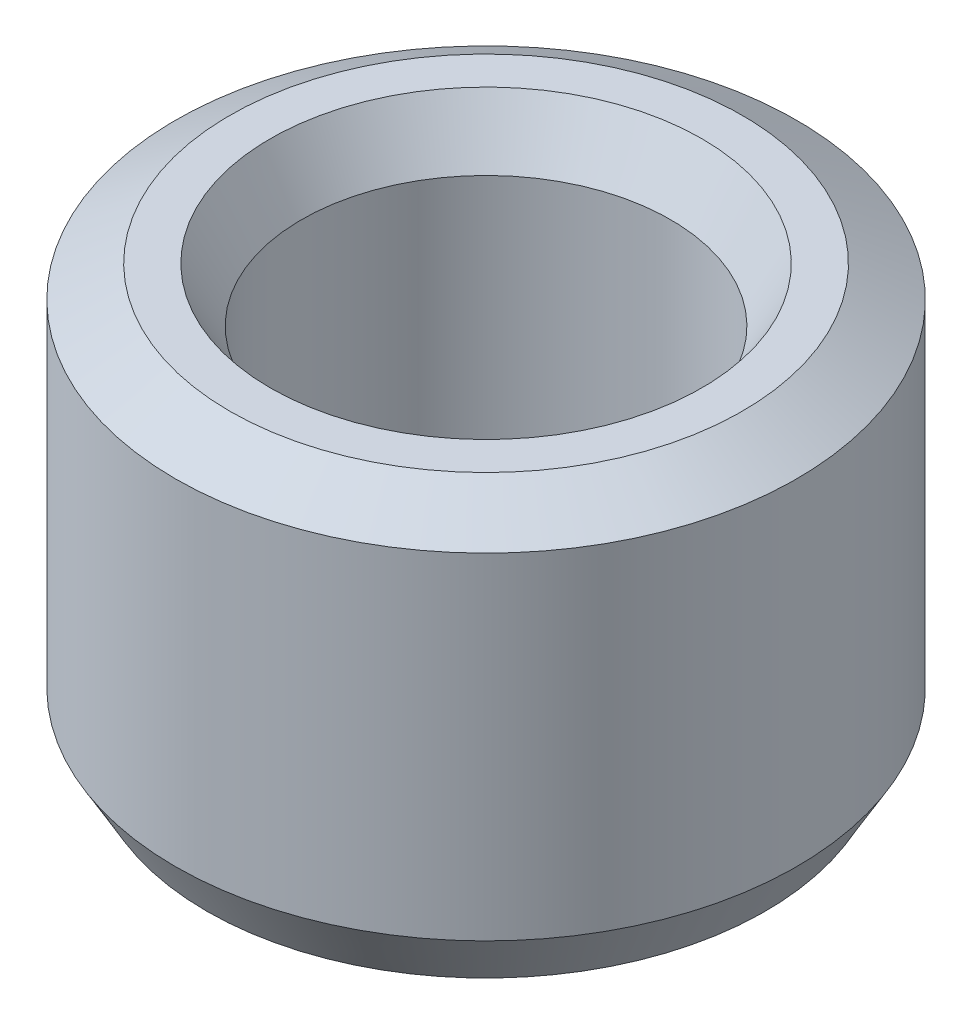
from build123d import *
from OCP.BRepFilletAPI import BRepFilletAPI_MakeChamfer

# Parameters (mm, degrees)
SKETCH1_R           = 15
BOSS_EXTRUDE1_DEPTH = 20.357849496
SKETCH2_R           = 8.90814744
CUT_EXTRUDE1_DEPTH  = 30.401395139
CHAMFER1_SIZE       = 1.515475572
CHAMFER1_SIZE2      = 2.624880689


with BuildPart() as part:
    # Sketch1 → Boss-Extrude1 (new body)
    with BuildSketch(Plane(origin=(0, 0, 0), x_dir=(1, 0, 0), z_dir=(0, 1, 0))):
        Circle(SKETCH1_R)
    extrude(amount=BOSS_EXTRUDE1_DEPTH)

    # Sketch2 → Cut-Extrude1 (cut, through all)
    with BuildSketch(Plane(origin=(0, 0, 0), x_dir=(1, 0, 0), z_dir=(0, 1, 0))):
        Circle(SKETCH2_R)
    extrude(amount=CUT_EXTRUDE1_DEPTH, mode=Mode.SUBTRACT)

    # Chamfer1: one chamfer whose edges measure the first distance from different faces: ONE call of the kernel's chamfer builder (chamfer() names one face for all edges)
    chamfer1_edges_1 = [part.edges().sort_by_distance(p)[0] for p in [
        (-8.90814744, 20.357849496, 0),
    ]]
    chamfer1_side_1 = [part.faces().sort_by_distance(p)[0] for p in [
        (-14.575735931, 20.357849496, 0),
    ]]
    chamfer1_edges_2 = [part.edges().sort_by_distance(p)[0] for p in [
        (-8.90814744, 0, 0),
    ]]
    chamfer1_side_2 = [part.faces().sort_by_distance(p)[0] for p in [
        (-8.90814744, 10.178924748, 0),
    ]]
    chamfer1_edges_3 = [part.edges().sort_by_distance(p)[0] for p in [
        (-15, 0, 0),
    ]]
    chamfer1_side_3 = [part.faces().sort_by_distance(p)[0] for p in [
        (-14.575735931, 0, 0),
    ]]
    chamfer1_edges_4 = [part.edges().sort_by_distance(p)[0] for p in [
        (-15, 20.357849496, 0),
    ]]
    chamfer1_side_4 = [part.faces().sort_by_distance(p)[0] for p in [
        (-15, 10.178924748, 0),
    ]]
    chamfer1 = BRepFilletAPI_MakeChamfer(part.part.solid().wrapped)
    for e in chamfer1_edges_1:
        chamfer1.Add(CHAMFER1_SIZE, CHAMFER1_SIZE2, e.wrapped, chamfer1_side_1[0].wrapped)  # the first distance lies on this face
    for e in chamfer1_edges_2:
        chamfer1.Add(CHAMFER1_SIZE, CHAMFER1_SIZE2, e.wrapped, chamfer1_side_2[0].wrapped)  # the first distance lies on this face
    for e in chamfer1_edges_3:
        chamfer1.Add(CHAMFER1_SIZE, CHAMFER1_SIZE2, e.wrapped, chamfer1_side_3[0].wrapped)  # the first distance lies on this face
    for e in chamfer1_edges_4:
        chamfer1.Add(CHAMFER1_SIZE, CHAMFER1_SIZE2, e.wrapped, chamfer1_side_4[0].wrapped)  # the first distance lies on this face
    add(Compound.cast(chamfer1.Shape()), mode=Mode.REPLACE)


solid = part.part
